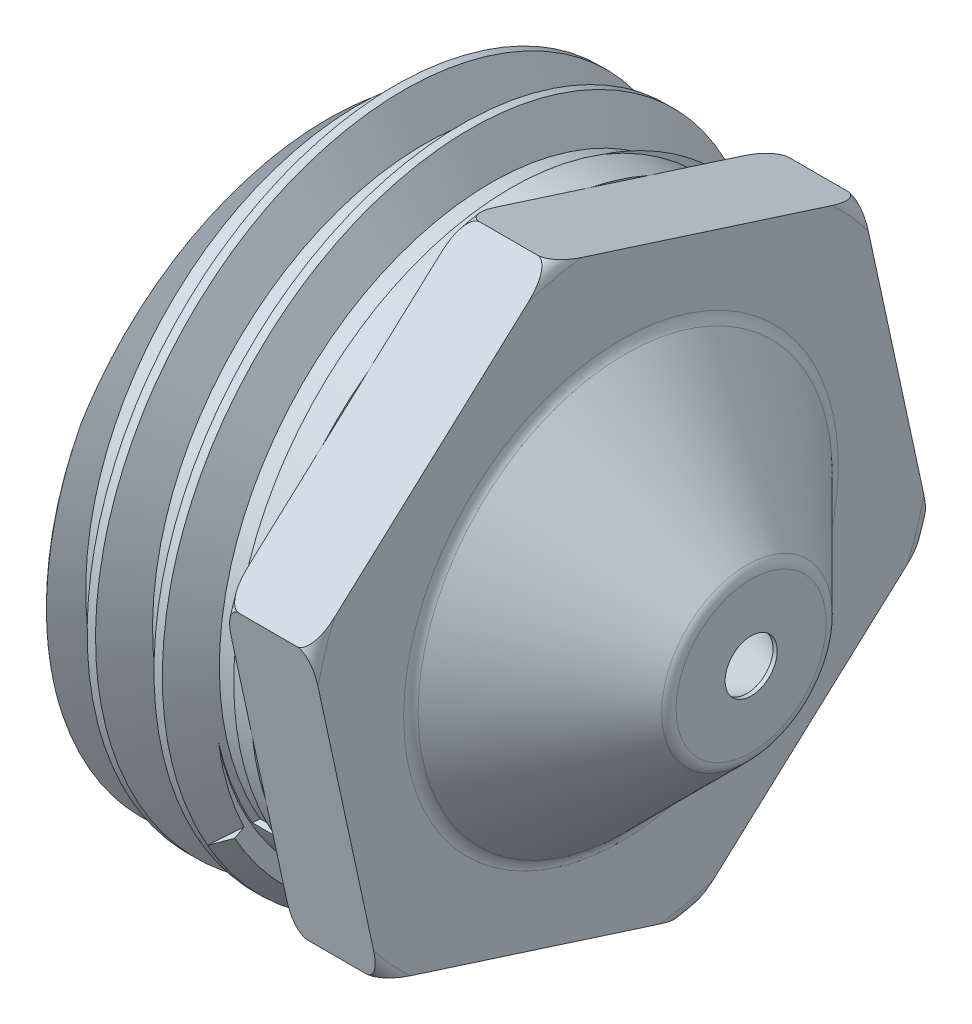
from build123d import *

# Parameters (mm, degrees)
SKETCH2_R               = 0.9
CUT_EXTRUDE1_DEPTH      = 22.177211539
FILLET2_R               = 0.5
CUT_EXTRUDE2_DEPTH      = 19.512814233
CUT_EXTRUDE2_DEPTH_BACK = 3
SKETCH3_OUTSIDE_W       = 31.418
SKETCH3_OUTSIDE_H       = 31.418
FILLET3_R               = 0.5
FILLET4_R               = 0.5
CHAMFER3_SIZE           = 0.5
THREAD1_PITCH           = 2.309090909
CHAMFER2_SIZE           = 8
CHAMFER2_SIZE2          = 13.856406461


with BuildPart() as part:
    # Sketch1 → Revolve1 (revolve)
    with BuildSketch(Plane.XY, mode=Mode.PRIVATE) as revolve1_sk:
        Polygon((14, 0), (14, 2.802582109), (9.5, 7.302582109), (9.5, 11.235530441), (6.5, 11.235530441), (6.5, 9.788150292), (5.195888176, 9.788150292), (5.195888176, 10.85335426), (0, 10.85335426), (0, 0), align=None)
    revolve(revolve1_sk.sketch.rotate(Axis((-1000, 0, 0), (1, 0, 0)), 90), axis=Axis((-1000, 0, 0), (1, 0, 0)))

    # Sketch2 → Cut-Extrude1 (cut, through all)
    with BuildSketch(Plane(origin=(14, 0, 0), x_dir=(0, 0, -1), z_dir=(1, 0, 0))):
        Circle(SKETCH2_R)
    extrude(amount=-CUT_EXTRUDE1_DEPTH, mode=Mode.SUBTRACT)

    # Fillet2
    fillet2_edges = [part.edges().sort_by_distance(p)[0] for p in [
        (6.5, 0, -11.235530441),
        (9.5, 0, -11.235530441),
    ]]
    fillet(fillet2_edges, radius=FILLET2_R)

    # Sketch3 outside → Cut-Extrude2 (cut, two sides: drawn at the far end of the back side and taken through both)
    with BuildSketch(Plane(origin=(9.5, 0, 0), x_dir=(0, 0, -1), z_dir=(1, 0, 0)).offset(-CUT_EXTRUDE2_DEPTH_BACK)):
        Rectangle(SKETCH3_OUTSIDE_W, SKETCH3_OUTSIDE_H)
        Polygon((8.318235959, 7.552754122), (-2.381758959, 10.980180716), (-10.699994917, 3.427426594), (-8.318235959, -7.552754122), (2.381758959, -10.980180716), (10.699994917, -3.427426594), align=None, mode=Mode.SUBTRACT)
    extrude(amount=CUT_EXTRUDE2_DEPTH + CUT_EXTRUDE2_DEPTH_BACK, mode=Mode.SUBTRACT)

    # Fillet3
    fillet3_edges = [part.edges().sort_by_distance(p)[0] for p in [
        (14, 0, -2.802582109),
    ]]
    fillet(fillet3_edges, radius=FILLET3_R)

    # Fillet4
    fillet4_edges = [part.edges().sort_by_distance(p)[0] for p in [
        (9.5, 0, -7.302582109),
    ]]
    fillet(fillet4_edges, radius=FILLET4_R)

    # Chamfer3
    chamfer3_edges = [part.edges().sort_by_distance(p)[0] for p in [
        (0, 0, -10.85335426),
        (5.195888176, 0, -10.85335426),
    ]]
    chamfer(chamfer3_edges, length=CHAMFER3_SIZE)

    # Thread1: the profile of Perfil de rosca1 profile screwed along a right-hand helix of 6.580896 turns, 10 arcs to a turn; built about Z, then put on its axis
    thread1_z = Axis((0, 0, 0), (0, 0, 1))
    thread1_corners = [(10.85365426, 0, -0.000173205), (10.85365426, 0, 2.020627744), (9.603522149, 0, 1.298863633), (9.603522149, 0, 0.721590906)]
    with BuildLine(mode=Mode.PRIVATE) as thread1_profile:
        Line(thread1_corners[0], thread1_corners[1])
        Line(thread1_corners[1], thread1_corners[2])
        Line(thread1_corners[2], thread1_corners[3])
        Line(thread1_corners[3], thread1_corners[0])
    thread1_cap = Face(thread1_profile.wire())
    thread1_turn_angles = [0, 18, 36, 54, 72, 90, 108, 126, 144, 162, 180, 198, 216, 234, 252, 270, 288, 306, 324, 342, 360]
    thread1_turn_weights = [1, 0.9510565162951535, 1, 0.9510565162951535, 1, 0.9510565162951535, 1, 0.9510565162951535, 1, 0.9510565162951535, 1, 0.9510565162951535, 1, 0.9510565162951535, 1, 0.9510565162951535, 1, 0.9510565162951535, 1, 0.9510565162951535, 1]
    thread1_turn_rails = [Edge.make_bspline([Vector(p[0], p[1], 0).rotate(thread1_z, thread1_turn_angles[k]) / thread1_turn_weights[k] + Vector(0, 0, p[2] + THREAD1_PITCH * thread1_turn_angles[k] / 360) for k in range(21)], [0, 0, 0, 1, 1, 2, 2, 3, 3, 4, 4, 5, 5, 6, 6, 7, 7, 8, 8, 9, 9, 10, 10, 10], 2, thread1_turn_weights) for p in thread1_corners]
    thread1_turn_sides = [Face.make_surface_from_curves(thread1_turn_rails[p[0]], thread1_turn_rails[p[1]]) for p in [(0, 1), (1, 2), (2, 3), (3, 0)]]
    thread1_last_angles = [2160, 2178, 2196, 2214, 2232, 2250, 2268, 2286, 2304, 2322, 2340, 2354.561361765, 2369.12272353]
    thread1_last_weights = [1, 0.9510565162951535, 1, 0.9510565162951535, 1, 0.9510565162951535, 1, 0.9510565162951535, 1, 0.9510565162951535, 1, 0.9678789370337293, 1]
    thread1_last_rails = [Edge.make_bspline([Vector(p[0], p[1], 0).rotate(thread1_z, thread1_last_angles[k]) / thread1_last_weights[k] + Vector(0, 0, p[2] + THREAD1_PITCH * thread1_last_angles[k] / 360) for k in range(13)], [0, 0, 0, 1, 1, 2, 2, 3, 3, 4, 4, 5, 5, 6, 6, 6], 2, thread1_last_weights) for p in thread1_corners]
    thread1_last_sides = [Face.make_surface_from_curves(thread1_last_rails[p[0]], thread1_last_rails[p[1]]) for p in [(0, 1), (1, 2), (2, 3), (3, 0)]]
    thread1 = Plane(origin=(-10.5, 0, 0), x_dir=(0, 0, -1), z_dir=(1, 0, 0)) * Solid(Shell([*[p.moved(Location((0, 0, THREAD1_PITCH * i))) for i in range(6) for p in thread1_turn_sides], *thread1_last_sides, thread1_cap, thread1_cap.rotate(thread1_z, 2369.12272353).moved(Location((0, 0, THREAD1_PITCH * 2369.12272353 / 360)))]))
    add(thread1, mode=Mode.SUBTRACT)

    # Chamfer2
    chamfer2_edges = [part.edges().sort_by_distance(p)[0] for p in [
        (0, 0, 0.9),
    ]]
    chamfer2_side = [part.faces().sort_by_distance(p)[0] for p in [
        (0, 8.479061084, 4.717866259),
    ]]
    chamfer(chamfer2_edges, length=CHAMFER2_SIZE, length2=CHAMFER2_SIZE2, reference=chamfer2_side[0])


solid = part.part
